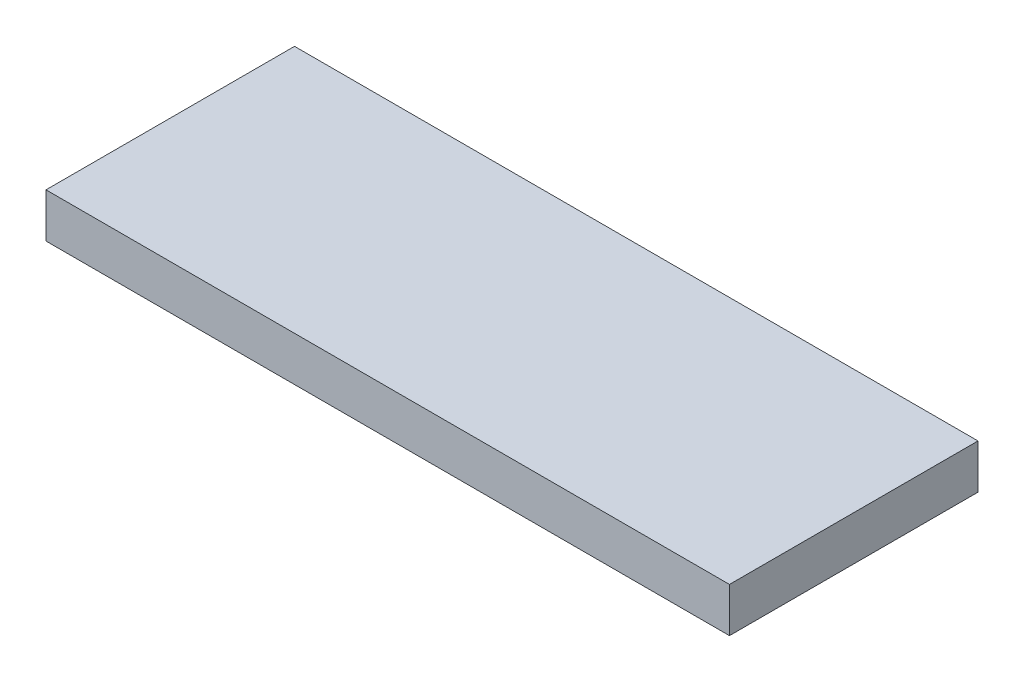
from build123d import *

# Parameters (mm, degrees)
SKETCH1_W  = 154
SKETCH1_H  = 56
BASE_DEPTH = 10


with BuildPart() as part:
    # Sketch1 → base (new body)
    with BuildSketch(Plane(origin=(0, 0, 0), x_dir=(1, 0, 0), z_dir=(0, 1, 0))):
        Rectangle(SKETCH1_W, SKETCH1_H)
    extrude(amount=BASE_DEPTH)


solid = part.part
